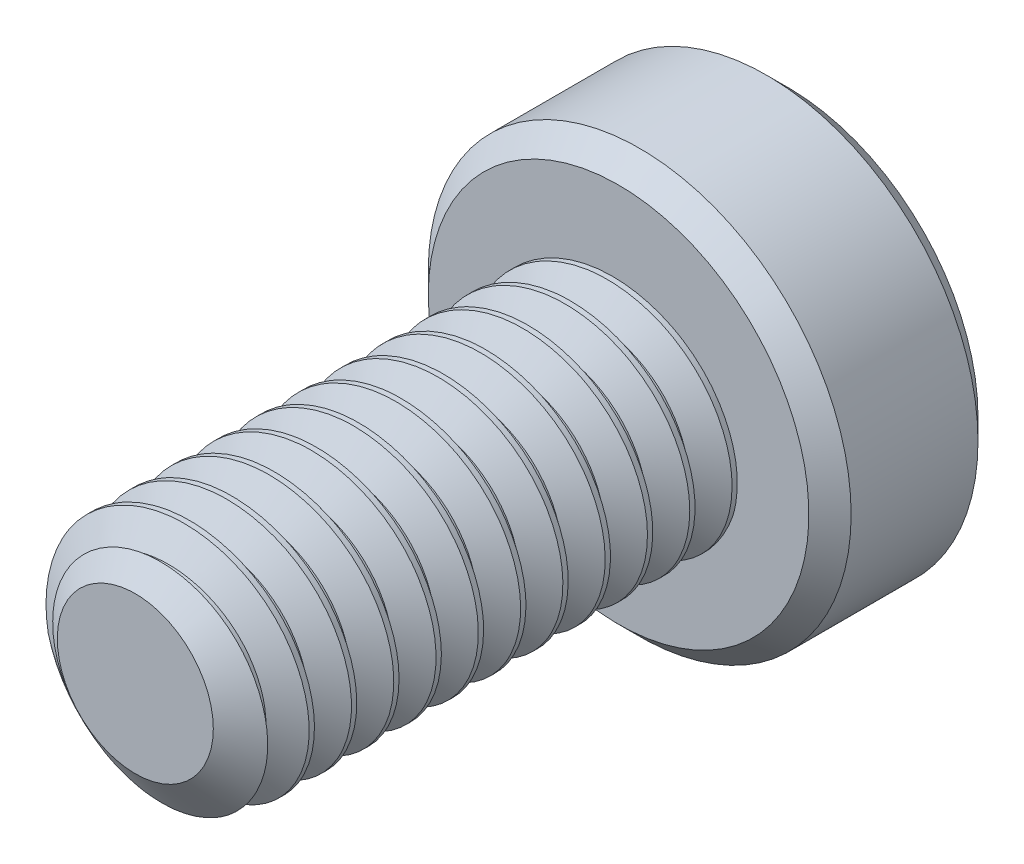
from build123d import *

# Parameters (mm, degrees)
SKETCH1_R          = 2
EXTRUDE1_DEPTH     = 8
CUT_SWEEP1_PITCH   = 0.7
SKETCH6_R          = 3.5
EXTRUDE2_DEPTH     = 2.8
CUT_EXTRUDE1_DEPTH = 1.875
CHAMFER1_SIZE      = 0.35


with BuildPart() as part:
    # Sketch1 → Extrude1 (new body)
    with BuildSketch(Plane.XY):
        Circle(SKETCH1_R)
    extrude(amount=-EXTRUDE1_DEPTH)

    # Cut-Sweep1: the profile of Sketch3 profile screwed along a right-hand helix of 12.428571 turns, 6 arcs to a turn; built about Z, then put on its axis
    cut_sweep1_z = Axis((0, 0, 0), (0, 0, 1))
    cut_sweep1_corners = [(2.0003, 0, -0.612673205), (1.545336663, 0, -0.35), (1.545336663, 0, -0.2625), (2.0003, 0, 0.000173205)]
    with BuildLine(mode=Mode.PRIVATE) as cut_sweep1_profile:
        Line(cut_sweep1_corners[0], cut_sweep1_corners[1])
        Line(cut_sweep1_corners[1], cut_sweep1_corners[2])
        Line(cut_sweep1_corners[2], cut_sweep1_corners[3])
        Line(cut_sweep1_corners[3], cut_sweep1_corners[0])
    cut_sweep1_cap = Face(cut_sweep1_profile.wire())
    cut_sweep1_turn_angles = [0, 30, 60, 90, 120, 150, 180, 210, 240, 270, 300, 330, 360]
    cut_sweep1_turn_weights = [1, 0.8660254037844387, 1, 0.8660254037844387, 1, 0.8660254037844387, 1, 0.8660254037844387, 1, 0.8660254037844387, 1, 0.8660254037844387, 1]
    cut_sweep1_turn_rails = [Edge.make_bspline([Vector(p[0], p[1], 0).rotate(cut_sweep1_z, cut_sweep1_turn_angles[k]) / cut_sweep1_turn_weights[k] + Vector(0, 0, p[2] + CUT_SWEEP1_PITCH * cut_sweep1_turn_angles[k] / 360) for k in range(13)], [0, 0, 0, 1, 1, 2, 2, 3, 3, 4, 4, 5, 5, 6, 6, 6], 2, cut_sweep1_turn_weights) for p in cut_sweep1_corners]
    cut_sweep1_turn_sides = [Face.make_surface_from_curves(cut_sweep1_turn_rails[p[0]], cut_sweep1_turn_rails[p[1]]) for p in [(0, 1), (1, 2), (2, 3), (3, 0)]]
    cut_sweep1_last_angles = [4320, 4350, 4380, 4410, 4440, 4457.142857143, 4474.285714286]
    cut_sweep1_last_weights = [1, 0.8660254037844387, 1, 0.8660254037844387, 1, 0.9555728057861561, 1]
    cut_sweep1_last_rails = [Edge.make_bspline([Vector(p[0], p[1], 0).rotate(cut_sweep1_z, cut_sweep1_last_angles[k]) / cut_sweep1_last_weights[k] + Vector(0, 0, p[2] + CUT_SWEEP1_PITCH * cut_sweep1_last_angles[k] / 360) for k in range(7)], [0, 0, 0, 1, 1, 2, 2, 3, 3, 3], 2, cut_sweep1_last_weights) for p in cut_sweep1_corners]
    cut_sweep1_last_sides = [Face.make_surface_from_curves(cut_sweep1_last_rails[p[0]], cut_sweep1_last_rails[p[1]]) for p in [(0, 1), (1, 2), (2, 3), (3, 0)]]
    cut_sweep1 = Plane(origin=(0, 0, 0), x_dir=(0, 1, 0), z_dir=(0, 0, -1)) * Solid(Shell([*[p.moved(Location((0, 0, CUT_SWEEP1_PITCH * i))) for i in range(12) for p in cut_sweep1_turn_sides], *cut_sweep1_last_sides, cut_sweep1_cap, cut_sweep1_cap.rotate(cut_sweep1_z, 4474.285714286).moved(Location((0, 0, CUT_SWEEP1_PITCH * 4474.285714286 / 360)))]))
    add(cut_sweep1, mode=Mode.SUBTRACT)

    # Sketch4 → Cut-Revolve1 (revolve, cut)
    with BuildSketch(Plane(origin=(0, 0, 0), x_dir=(0, 0, -1), z_dir=(1, 0, 0)), mode=Mode.PRIVATE) as cut_revolve1_sk:
        Polygon((0.496211411, 2), (0, 1.291336663), (0, 2), align=None)
    revolve(cut_revolve1_sk.sketch.rotate(Axis((0, 0, 0), (0, 0, -1)), 271.401126896), axis=Axis((0, 0, 0), (0, 0, -1)), mode=Mode.SUBTRACT)

    # Sketch6 → Extrude2 (add)
    with BuildSketch(Plane(origin=(0, 0, -8), x_dir=(-1, 0, 0), z_dir=(0, 0, -1))):
        Circle(SKETCH6_R)
    extrude(amount=EXTRUDE2_DEPTH)

    # Sketch7 → Cut-Extrude1 (cut)
    with BuildSketch(Plane(origin=(0, 0, -10.8), x_dir=(-1, 0, 0), z_dir=(0, 0, -1))):
        Polygon((0, 1.443375673), (-1.25, 0.721687836), (-1.25, -0.721687836), (0, -1.443375673), (1.25, -0.721687836), (1.25, 0.721687836), align=None)
    extrude(amount=-CUT_EXTRUDE1_DEPTH, mode=Mode.SUBTRACT)

    # Cut-Extrude2 cone 1 section (through the dimple's axis) → Cut-Extrude2 (revolve, cut)
    with BuildSketch(Plane(origin=(0, 0, -10.8), x_dir=(0, 1, 0), z_dir=(1, 0, 0))):
        Polygon((0, 0), (1.443375673, 0), (0, 1.443375673), align=None)
    revolve(axis=Axis((0, 0, -10.8), (0, 0, 1)), mode=Mode.SUBTRACT)

    # Chamfer1
    chamfer1_edges = [part.edges().sort_by_distance(p)[0] for p in [
        (3.5, 0, -8),
        (3.5, 0, -10.8),
    ]]
    chamfer(chamfer1_edges, length=CHAMFER1_SIZE)


solid = part.part
